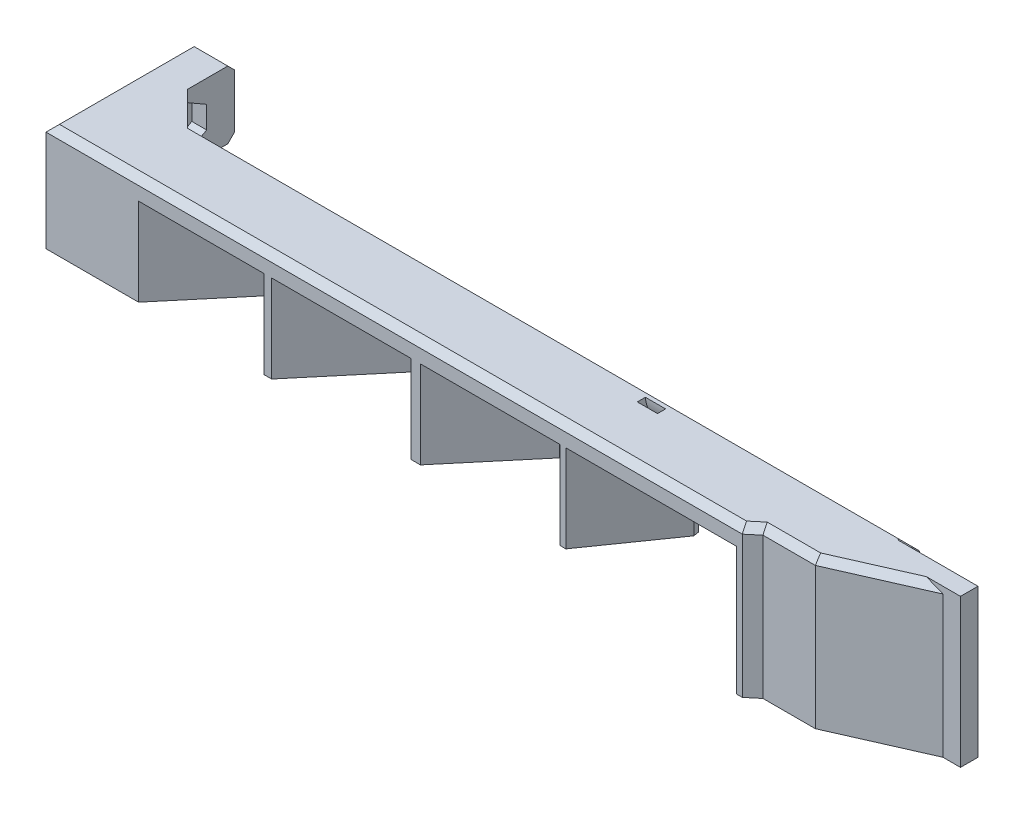
from build123d import *
from OCP.BRepFilletAPI import BRepFilletAPI_MakeChamfer

# Parameters (mm, degrees)
SKETCH1_W           = 126
SKETCH1_H           = 12
BOSS_EXTRUDE1_DEPTH = 16
SKETCH2_W           = 6
SKETCH2_H           = 16
BOSS_EXTRUDE2_DEPTH = 10
SKETCH3_R           = 1.8
CUT_EXTRUDE1_DEPTH  = 10
CUT_EXTRUDE2_DEPTH  = 2.2
CHAMFER1_SIZE       = 3
CUT_EXTRUDE4_DEPTH  = 12
CUT_EXTRUDE5_DEPTH  = 6
SKETCH8_W           = 8.301447347
SKETCH8_H           = 4
CUT_EXTRUDE6_DEPTH  = 2.2
CUT_EXTRUDE7_DEPTH  = 112.589774522
SKETCH10_W          = 2.6
SKETCH10_H          = 16
BOSS_EXTRUDE3_DEPTH = 2.6
CHAMFER2_SIZE       = 2
CHAMFER3_SIZE       = 1
CHAMFER3_SIZE2      = 0.709807814
CHAMFER3_SIZE2_2    = 0.718015043
CUT_EXTRUDE8_START  = -12
SKETCH11_R          = 6
SKETCH11_R_2        = 4.8
CUT_EXTRUDE8_DEPTH  = 3
BOSS_EXTRUDE4_DEPTH = 6
CHAMFER4_SIZE       = 1
CUT_EXTRUDE9_START  = -46
SKETCH13_R          = 6
SKETCH13_R_2        = 4.8
CUT_EXTRUDE9_DEPTH  = 3


with BuildPart() as part:
    # Sketch1 → Boss-Extrude1 (new body)
    with BuildSketch(Plane(origin=(0, 0, 0), x_dir=(1, 0, 0), z_dir=(0, 1, 0))):
        with Locations((46.5, 1.833333333)):
            Rectangle(SKETCH1_W, SKETCH1_H)
    extrude(amount=BOSS_EXTRUDE1_DEPTH)

    # Sketch2 → Boss-Extrude2 (add)
    with BuildSketch(Plane(origin=(0, 0, -7.833333333), x_dir=(-1, 0, 0), z_dir=(0, 0, -1))):
        with Locations((13.5, 8)):
            Rectangle(SKETCH2_W, SKETCH2_H)
    extrude(amount=BOSS_EXTRUDE2_DEPTH)

    # Sketch3 → Cut-Extrude1 (cut)
    with BuildSketch(Plane(origin=(-10.5, 0, 0), x_dir=(0, 0, -1), z_dir=(1, 0, 0))):
        with Locations((10.833333333, 11)):
            Circle(SKETCH3_R)
    extrude(amount=-CUT_EXTRUDE1_DEPTH, mode=Mode.SUBTRACT)

    # Sketch4 → Cut-Extrude2 (cut)
    with BuildSketch(Plane(origin=(-10.5, 0, 0), x_dir=(0, 0, -1), z_dir=(1, 0, 0))):
        Polygon((7.983333333, 12.645448267), (7.983333333, 9.354551733), (10.833333333, 7.709103466), (13.683333333, 9.354551733), (13.683333333, 12.645448267), (10.833333333, 14.290896534), align=None)
    extrude(amount=-CUT_EXTRUDE2_DEPTH, mode=Mode.SUBTRACT)

    # Chamfer1
    # the kernel refuses this chamfer: 3 mm, written as the material it adds along each edge
    with BuildSketch(Plane(origin=(-10.5, 0, -7.833333333), x_dir=(1, 0, 0), z_dir=(0, 1, 0))) as chamfer1_piece_1_section:
        Polygon((CHAMFER1_SIZE, 0), (0, CHAMFER1_SIZE), (0, 0), align=None)
    chamfer1_piece_1 = extrude(amount=16, mode=Mode.PRIVATE)
    chamfer1_piece_1 = split(chamfer1_piece_1, bisect_by=Plane(origin=(-10.5, 0, -7.983333333), z_dir=(0, 0, 1)), keep=Keep.TOP, mode=Mode.PRIVATE)
    add(chamfer1_piece_1)
    with BuildSketch(Plane(origin=(-10.5, 0, -7.833333333), x_dir=(1, 0, 0), z_dir=(0, 1, 0))) as chamfer1_piece_2_section:
        Polygon((CHAMFER1_SIZE, 0), (0, CHAMFER1_SIZE), (0, 0), align=None)
    chamfer1_piece_2 = extrude(amount=23.715048964, mode=Mode.PRIVATE)
    chamfer1_piece_2 = split(chamfer1_piece_2, bisect_by=Plane(origin=(-10.5, 7.080865705, -11.921473054), z_dir=(0, -0.8660254037844421, 0.499999999999994)), keep=Keep.TOP, mode=Mode.PRIVATE)
    add(chamfer1_piece_2)
    with BuildSketch(Plane(origin=(-10.5, -7.715048964, -7.833333333), x_dir=(1, 0, 0), z_dir=(0, 1, 0))) as chamfer1_piece_3_section:
        Polygon((CHAMFER1_SIZE, 0), (0, CHAMFER1_SIZE), (0, 0), align=None)
    chamfer1_piece_3 = extrude(amount=23.715048964, mode=Mode.PRIVATE)
    chamfer1_piece_3 = split(chamfer1_piece_3, bisect_by=Plane(origin=(-10.5, 7.490372054, 0.945520585), z_dir=(0, 0.8660254037844354, 0.5000000000000058)), keep=Keep.TOP, mode=Mode.PRIVATE)
    add(chamfer1_piece_3)

    # Sketch6 → Cut-Extrude4 (cut)
    with BuildSketch(Plane.XZ):
        Polygon((27.078053453, -7.833333333), (47.078053453, -7.833333333), (37.008857879, 4.166666667), (17.008857879, 4.166666667), align=None)
        Polygon((49.166705116, -7.833333333), (67.5, -7.833333333), (59.097509541, 4.166666667), (39.097509541, 4.166666667), align=None)
        Polygon((7.316705116, -7.833333333), (25.228053453, -7.833333333), (15.158857879, 4.166666667), (-2.752490459, 4.166666667), (-1.819672283, 3.054977255), align=None)
        Polygon((60.697509541, 4.166666667), (69.1, -7.833333333), (99.598552653, -7.833333333), (85.297509541, 4.166666667), align=None)
        Polygon((109.5, 2.766666667), (96.345030751, 2.766666667), (109.5, -3.033333333), align=None)
        Polygon((93.814978285, -1.637778805), (96.908239719, -4.233333333), (106.747497018, -4.233333333), (106.747497018, -3.349795), (96.258797751, 1.274651823), align=None)
        Polygon((98.576694749, -5.633333333), (101.198552653, -7.833333333), (109.5, -7.833333333), (109.5, -5.633333333), align=None)
        Polygon((109.5, 4.166666667), (86.897509541, 4.166666667), (88.565964571, 2.766666667), (96.345030751, 2.766666667), (109.5, 2.766666667), align=None)
    extrude(amount=-CUT_EXTRUDE4_DEPTH, mode=Mode.SUBTRACT)

    # Sketch7 → Cut-Extrude5 (cut)
    with BuildSketch(Plane.XZ):
        Polygon((5.466705116, -7.833333333), (-2.924291196, 2.166666667), (-16.5, 2.166666667), (-16.5, -17.833333333), (-10.5, -17.833333333), (-10.5, -10.833333333), (-7.5, -7.833333333), align=None)
    extrude(amount=-CUT_EXTRUDE5_DEPTH, mode=Mode.SUBTRACT)

    # Sketch8 → Cut-Extrude6 (cut)
    with BuildSketch(Plane(origin=(0, 0, -7.833333333), x_dir=(-1, 0, 0), z_dir=(0, 0, -1))):
        with Locations((-105.349276327, 14)):
            Rectangle(SKETCH8_W, SKETCH8_H)
    extrude(amount=-CUT_EXTRUDE6_DEPTH, mode=Mode.SUBTRACT)

    # Sketch9 → Cut-Extrude7 (cut, through all)
    with BuildSketch(Plane.XZ.offset(-12)):
        Polygon((109.5, -3.033333333), (109.5, 4.166666667), (86.897509541, 4.166666667), (88.565964571, 2.766666667), (96.345030751, 2.766666667), align=None)
    extrude(amount=-CUT_EXTRUDE7_DEPTH, mode=Mode.SUBTRACT)

    # Sketch10 → Boss-Extrude3 (add)
    with BuildSketch(Plane(origin=(109.5, 0, 0), x_dir=(0, 0, -1), z_dir=(1, 0, 0))):
        with Locations((4.333333333, 8)):
            Rectangle(SKETCH10_W, SKETCH10_H)
    extrude(amount=BOSS_EXTRUDE3_DEPTH)

    # Chamfer2
    chamfer2_edges = [part.edges().sort_by_distance(p)[0] for p in [
        (46.849276326, 16, -7.833333333),
    ]]
    chamfer(chamfer2_edges, length=CHAMFER2_SIZE)

    # Chamfer3: one chamfer whose edges measure the first distance from different faces: ONE call of the kernel's chamfer builder (chamfer() names one face for all edges)
    chamfer3_edges_1 = [part.edges().sort_by_distance(p)[0] for p in [
        (7.316705116, 6, -7.833333333),
    ]]
    chamfer3_side_1 = [part.faces().sort_by_distance(p)[0] for p in [
        (2.282107329, 6, -1.833333333),
    ]]
    chamfer3_edges_2 = [part.edges().sort_by_distance(p)[0] for p in [
        (15.158857879, 6, 4.166666667),
    ]]
    chamfer3_side_2 = [part.faces().sort_by_distance(p)[0] for p in [
        (20.193455666, 6, -1.833333333),
    ]]
    chamfer3_edges_3 = [part.edges().sort_by_distance(p)[0] for p in [
        (59.097509541, 6, 4.166666667),
    ]]
    chamfer3_side_3 = [part.faces().sort_by_distance(p)[0] for p in [
        (63.298754771, 6, -1.833333333),
    ]]
    chamfer3_edges_4 = [part.edges().sort_by_distance(p)[0] for p in [
        (49.166705116, 6, -7.833333333),
    ]]
    chamfer3_side_4 = [part.faces().sort_by_distance(p)[0] for p in [
        (44.132107329, 6, -1.833333333),
    ]]
    chamfer3_edges_5 = [part.edges().sort_by_distance(p)[0] for p in [
        (37.008857879, 6, 4.166666667),
    ]]
    chamfer3_side_5 = [part.faces().sort_by_distance(p)[0] for p in [
        (42.043455666, 6, -1.833333333),
    ]]
    chamfer3_edges_6 = [part.edges().sort_by_distance(p)[0] for p in [
        (27.078053453, 6, -7.833333333),
    ]]
    chamfer3_side_6 = [part.faces().sort_by_distance(p)[0] for p in [
        (22.043455666, 6, -1.833333333),
    ]]
    chamfer3_edges_7 = [part.edges().sort_by_distance(p)[0] for p in [
        (-13.5, 16, -17.833333333),
        (-13.5, 6, -17.833333333),
        (-16.5, 16, -6.833333333),
        (35.198754771, 16, 4.166666667),
    ]]
    chamfer3_edges_8 = [part.edges().sort_by_distance(p)[0] for p in [
        (85.297509541, 6, 4.166666667),
    ]]
    chamfer3_side_8 = [part.faces().sort_by_distance(p)[0] for p in [
        (92.448031097, 6, -1.833333333),
    ]]
    chamfer3_edges_9 = [part.edges().sort_by_distance(p)[0] for p in [
        (69.1, 6, -7.833333333),
    ]]
    chamfer3_side_9 = [part.faces().sort_by_distance(p)[0] for p in [
        (64.898754771, 6, -1.833333333),
    ]]
    chamfer3 = BRepFilletAPI_MakeChamfer(part.part.solid().wrapped)
    for e in chamfer3_edges_1:
        chamfer3.Add(CHAMFER3_SIZE, CHAMFER3_SIZE2, e.wrapped, chamfer3_side_1[0].wrapped)  # the first distance lies on this face
    for e in chamfer3_edges_2:
        chamfer3.Add(CHAMFER3_SIZE, CHAMFER3_SIZE2, e.wrapped, chamfer3_side_2[0].wrapped)  # the first distance lies on this face
    for e in chamfer3_edges_3:
        chamfer3.Add(CHAMFER3_SIZE, CHAMFER3_SIZE2_2, e.wrapped, chamfer3_side_3[0].wrapped)  # the first distance lies on this face
    for e in chamfer3_edges_4:
        chamfer3.Add(CHAMFER3_SIZE, CHAMFER3_SIZE2, e.wrapped, chamfer3_side_4[0].wrapped)  # the first distance lies on this face
    for e in chamfer3_edges_5:
        chamfer3.Add(CHAMFER3_SIZE, CHAMFER3_SIZE2, e.wrapped, chamfer3_side_5[0].wrapped)  # the first distance lies on this face
    for e in chamfer3_edges_6:
        chamfer3.Add(CHAMFER3_SIZE, CHAMFER3_SIZE2, e.wrapped, chamfer3_side_6[0].wrapped)  # the first distance lies on this face
    for e in chamfer3_edges_7:
        chamfer3.Add(CHAMFER3_SIZE, e.wrapped)
    for e in chamfer3_edges_8:
        chamfer3.Add(CHAMFER3_SIZE, CHAMFER3_SIZE2, e.wrapped, chamfer3_side_8[0].wrapped)  # the first distance lies on this face
    for e in chamfer3_edges_9:
        chamfer3.Add(CHAMFER3_SIZE, CHAMFER3_SIZE2_2, e.wrapped, chamfer3_side_9[0].wrapped)  # the first distance lies on this face
    add(Compound.cast(chamfer3.Shape()), mode=Mode.REPLACE)

    # Sketch11 → Cut-Extrude8 (cut)
    with BuildSketch(Plane.ZY.offset(16.5).offset(CUT_EXTRUDE8_START)):
        with Locations((-9.833333333, 6)):
            Circle(SKETCH11_R)
        with Locations((-9.833333333, 6)):
            Circle(SKETCH11_R_2, mode=Mode.SUBTRACT)
    extrude(amount=-CUT_EXTRUDE8_DEPTH, mode=Mode.SUBTRACT)

    # Sketch12 → Boss-Extrude4 (add)
    with BuildSketch(Plane.XZ):
        Polygon((86.007317356, 4.166666667), (86.063553985, 3.523879057), (99.598552653, -7.833333333), (101.198552653, -7.833333333), (98.576694749, -5.633333333), (112.1, -5.633333333), (112.1, -3.033333333), (109.5, -3.033333333), (96.345030751, 2.766666667), (88.565964571, 2.766666667), (86.897509541, 4.166666667), align=None)
        Polygon((96.258797751, 1.274651823), (93.814978285, -1.637778805), (96.908239719, -4.233333333), (106.747497018, -4.233333333), (106.747497018, -3.349795), align=None, mode=Mode.SUBTRACT)
    extrude(amount=BOSS_EXTRUDE4_DEPTH)

    # Chamfer4
    # the kernel refuses this chamfer: 1 mm, written as the material it takes off along each edge
    with BuildSketch(Plane(origin=(-5.324173446, 12, 4.166666667), x_dir=(0, 1, 0), z_dir=(1, 0, 0))) as chamfer4_piece_1_section:
        Polygon((CHAMFER4_SIZE, 0), (0, -CHAMFER4_SIZE), (0, 0), align=None)
    chamfer4_piece_1 = extrude(amount=23.764522127, mode=Mode.PRIVATE)
    chamfer4_piece_1 = split(chamfer4_piece_1, bisect_by=Plane(origin=(-3.81504792, 12, 5.432973339), z_dir=(0.7660444431189749, 0, 0.6427876096865432)), keep=Keep.TOP, mode=Mode.PRIVATE)
    chamfer4_piece_1 = split(chamfer4_piece_1, bisect_by=Plane(origin=(6.695762747, 12, 14.252590694), z_dir=(-0.766044443118975, 0, -0.642787609686543)), keep=Keep.TOP, mode=Mode.PRIVATE)
    add(chamfer4_piece_1, mode=Mode.SUBTRACT)
    with BuildSketch(Plane(origin=(-5.324173446, 12, 4.166666667), x_dir=(0, 1, 0), z_dir=(1, 0, 0))) as chamfer4_piece_2_section:
        Polygon((CHAMFER4_SIZE, 0), (0, -CHAMFER4_SIZE), (0, 0), align=None)
    chamfer4_piece_2 = extrude(amount=23.764522127, mode=Mode.PRIVATE)
    chamfer4_piece_2 = split(chamfer4_piece_2, bisect_by=Plane(origin=(15.707682269, 12, 2.326617719), z_dir=(-0.9961946980917459, 0, 0.08715574274765488)), keep=Keep.TOP, mode=Mode.PRIVATE)
    chamfer4_piece_2 = split(chamfer4_piece_2, bisect_by=Plane(origin=(6.695762747, 12, 14.252590694), z_dir=(0.766044443118975, 0, 0.642787609686543)), keep=Keep.TOP, mode=Mode.PRIVATE)
    add(chamfer4_piece_2, mode=Mode.SUBTRACT)
    with BuildSketch(Plane(origin=(-5.324173446, 12, 4.166666667), x_dir=(0, 1, 0), z_dir=(1, 0, 0))) as chamfer4_piece_3_section:
        Polygon((CHAMFER4_SIZE, 0), (0, -CHAMFER4_SIZE), (0, 0), align=None)
    chamfer4_piece_3 = extrude(amount=23.764522127, mode=Mode.PRIVATE)
    chamfer4_piece_3 = split(chamfer4_piece_3, bisect_by=Plane(origin=(7.781387312, 12, 15.163537865), z_dir=(0.7660444431189742, 0, 0.642787609686544)), keep=Keep.TOP, mode=Mode.PRIVATE)
    add(chamfer4_piece_3, mode=Mode.SUBTRACT)
    with BuildSketch(Plane(origin=(36.525826554, 12, 4.166666667), x_dir=(0, 1, 0), z_dir=(1, 0, 0))) as chamfer4_piece_4_section:
        Polygon((CHAMFER4_SIZE, 0), (0, -CHAMFER4_SIZE), (0, 0), align=None)
    chamfer4_piece_4 = extrude(amount=25.861381019, mode=Mode.PRIVATE)
    chamfer4_piece_4 = split(chamfer4_piece_4, bisect_by=Plane(origin=(36.809280971, 12, 4.404513164), z_dir=(-0.7660444431189739, 0, -0.6427876096865442)), keep=Keep.TOP, mode=Mode.PRIVATE)
    add(chamfer4_piece_4, mode=Mode.SUBTRACT)
    with BuildSketch(Plane(origin=(36.525826554, 12, 4.166666667), x_dir=(0, 1, 0), z_dir=(1, 0, 0))) as chamfer4_piece_5_section:
        Polygon((CHAMFER4_SIZE, 0), (0, -CHAMFER4_SIZE), (0, 0), align=None)
    chamfer4_piece_5 = extrude(amount=25.861381019, mode=Mode.PRIVATE)
    chamfer4_piece_5 = split(chamfer4_piece_5, bisect_by=Plane(origin=(37.709604739, 12, 4.063099495), z_dir=(-0.9961946980917457, 0, 0.0871557427476573)), keep=Keep.TOP, mode=Mode.PRIVATE)
    add(chamfer4_piece_5, mode=Mode.SUBTRACT)
    with BuildSketch(Plane(origin=(36.525826554, 12, 4.166666667), x_dir=(0, 1, 0), z_dir=(1, 0, 0))) as chamfer4_piece_6_section:
        Polygon((CHAMFER4_SIZE, 0), (0, -CHAMFER4_SIZE), (0, 0), align=None)
    chamfer4_piece_6 = extrude(amount=25.861381019, mode=Mode.PRIVATE)
    chamfer4_piece_6 = split(chamfer4_piece_6, bisect_by=Plane(origin=(38.03495208, 12, 5.432973339), z_dir=(0.7660444431189741, 0, 0.6427876096865441)), keep=Keep.TOP, mode=Mode.PRIVATE)
    chamfer4_piece_6 = split(chamfer4_piece_6, bisect_by=Plane(origin=(51.671653173, 12, 14.771888638), z_dir=(-0.8191520442889891, 0, -0.57357643635105)), keep=Keep.TOP, mode=Mode.PRIVATE)
    add(chamfer4_piece_6, mode=Mode.SUBTRACT)
    with BuildSketch(Plane(origin=(36.525826554, 12, 4.166666667), x_dir=(0, 1, 0), z_dir=(1, 0, 0))) as chamfer4_piece_7_section:
        Polygon((CHAMFER4_SIZE, 0), (0, -CHAMFER4_SIZE), (0, 0), align=None)
    chamfer4_piece_7 = extrude(amount=25.861381019, mode=Mode.PRIVATE)
    chamfer4_piece_7 = split(chamfer4_piece_7, bisect_by=Plane(origin=(59.113254259, 12, 0.183893737), z_dir=(-0.9848077530122082, 0, 0.17364817766692958)), keep=Keep.TOP, mode=Mode.PRIVATE)
    chamfer4_piece_7 = split(chamfer4_piece_7, bisect_by=Plane(origin=(51.671653173, 12, 14.771888638), z_dir=(0.8191520442889891, 0, 0.57357643635105)), keep=Keep.TOP, mode=Mode.PRIVATE)
    add(chamfer4_piece_7, mode=Mode.SUBTRACT)
    with BuildSketch(Plane(origin=(36.525826554, 12, 4.166666667), x_dir=(0, 1, 0), z_dir=(1, 0, 0))) as chamfer4_piece_8_section:
        Polygon((CHAMFER4_SIZE, 0), (0, -CHAMFER4_SIZE), (0, 0), align=None)
    chamfer4_piece_8 = extrude(amount=25.861381019, mode=Mode.PRIVATE)
    chamfer4_piece_8 = split(chamfer4_piece_8, bisect_by=Plane(origin=(52.745269287, 12, 15.523642735), z_dir=(0.8191520442889892, 0, 0.5735764363510499)), keep=Keep.TOP, mode=Mode.PRIVATE)
    add(chamfer4_piece_8, mode=Mode.SUBTRACT)
    with BuildSketch(Plane(origin=(14.437174891, 12, 4.166666667), x_dir=(0, 1, 0), z_dir=(1, 0, 0))) as chamfer4_piece_9_section:
        Polygon((CHAMFER4_SIZE, 0), (0, -CHAMFER4_SIZE), (0, 0), align=None)
    chamfer4_piece_9 = extrude(amount=25.85317379, mode=Mode.PRIVATE)
    chamfer4_piece_9 = split(chamfer4_piece_9, bisect_by=Plane(origin=(14.860675852, 12, 4.522026168), z_dir=(-0.766044443118975, 0, -0.642787609686543)), keep=Keep.TOP, mode=Mode.PRIVATE)
    add(chamfer4_piece_9, mode=Mode.SUBTRACT)
    with BuildSketch(Plane(origin=(14.437174891, 12, 4.166666667), x_dir=(0, 1, 0), z_dir=(1, 0, 0))) as chamfer4_piece_10_section:
        Polygon((CHAMFER4_SIZE, 0), (0, -CHAMFER4_SIZE), (0, 0), align=None)
    chamfer4_piece_10 = extrude(amount=25.85317379, mode=Mode.PRIVATE)
    chamfer4_piece_10 = split(chamfer4_piece_10, bisect_by=Plane(origin=(15.857791912, 12, 4.042378782), z_dir=(-0.9961946980917459, 0, 0.08715574274765488)), keep=Keep.TOP, mode=Mode.PRIVATE)
    add(chamfer4_piece_10, mode=Mode.SUBTRACT)
    with BuildSketch(Plane(origin=(14.437174891, 12, 4.166666667), x_dir=(0, 1, 0), z_dir=(1, 0, 0))) as chamfer4_piece_11_section:
        Polygon((CHAMFER4_SIZE, 0), (0, -CHAMFER4_SIZE), (0, 0), align=None)
    chamfer4_piece_11 = extrude(amount=25.85317379, mode=Mode.PRIVATE)
    chamfer4_piece_11 = split(chamfer4_piece_11, bisect_by=Plane(origin=(15.946300417, 12, 5.432973339), z_dir=(0.7660444431189742, 0, 0.642787609686544)), keep=Keep.TOP, mode=Mode.PRIVATE)
    chamfer4_piece_11 = split(chamfer4_piece_11, bisect_by=Plane(origin=(27.682782193, 12, 15.281050869), z_dir=(-0.7660444431189739, 0, -0.6427876096865442)), keep=Keep.TOP, mode=Mode.PRIVATE)
    add(chamfer4_piece_11, mode=Mode.SUBTRACT)
    with BuildSketch(Plane(origin=(14.437174891, 12, 4.166666667), x_dir=(0, 1, 0), z_dir=(1, 0, 0))) as chamfer4_piece_12_section:
        Polygon((CHAMFER4_SIZE, 0), (0, -CHAMFER4_SIZE), (0, 0), align=None)
    chamfer4_piece_12 = extrude(amount=25.85317379, mode=Mode.PRIVATE)
    chamfer4_piece_12 = split(chamfer4_piece_12, bisect_by=Plane(origin=(37.541816614, 12, 2.145272441), z_dir=(-0.9961946980917457, 0, 0.0871557427476573)), keep=Keep.TOP, mode=Mode.PRIVATE)
    chamfer4_piece_12 = split(chamfer4_piece_12, bisect_by=Plane(origin=(27.682782193, 12, 15.281050869), z_dir=(0.7660444431189739, 0, 0.6427876096865442)), keep=Keep.TOP, mode=Mode.PRIVATE)
    add(chamfer4_piece_12, mode=Mode.SUBTRACT)
    with BuildSketch(Plane(origin=(14.437174891, 12, 4.166666667), x_dir=(0, 1, 0), z_dir=(1, 0, 0))) as chamfer4_piece_13_section:
        Polygon((CHAMFER4_SIZE, 0), (0, -CHAMFER4_SIZE), (0, 0), align=None)
    chamfer4_piece_13 = extrude(amount=25.85317379, mode=Mode.PRIVATE)
    chamfer4_piece_13 = split(chamfer4_piece_13, bisect_by=Plane(origin=(28.908453302, 12, 16.309511045), z_dir=(0.7660444431189741, 0, 0.6427876096865441)), keep=Keep.TOP, mode=Mode.PRIVATE)
    add(chamfer4_piece_13, mode=Mode.SUBTRACT)
    with BuildSketch(Plane(origin=(101.198552653, 16, -8.405016321), x_dir=(-1, 0, 0), z_dir=(0, 0, 1))) as chamfer4_piece_14:
        Polygon((CHAMFER4_SIZE, 0), (0, CHAMFER4_SIZE), (0, 0), align=None)
    extrude(amount=2.771682988, mode=Mode.SUBTRACT)
    with BuildSketch(Plane(origin=(101.198552653, 12, -10.405016321), x_dir=(-1, 0, 0), z_dir=(0, 0, 1))) as chamfer4_piece_15_section:
        Polygon((CHAMFER4_SIZE, 0), (0, -CHAMFER4_SIZE), (0, 0), align=None)
    chamfer4_piece_15 = extrude(amount=4.771682988, mode=Mode.PRIVATE)
    chamfer4_piece_15 = split(chamfer4_piece_15, bisect_by=Plane(origin=(102.464859325, 12, -8.895890795), z_dir=(0.6427876096865404, 0, 0.7660444431189771)), keep=Keep.TOP, mode=Mode.PRIVATE)
    add(chamfer4_piece_15, mode=Mode.SUBTRACT)
    with BuildSketch(Plane(origin=(111.853120449, 16, -4.070819499), x_dir=(0, -1, 0), z_dir=(-0.9150118657328382, 0, 0.40342692717282824))) as chamfer4_piece_16_section:
        Polygon((CHAMFER4_SIZE, 0), (0, -CHAMFER4_SIZE), (0, 0), align=None)
    chamfer4_piece_16 = extrude(amount=19.52019511, mode=Mode.PRIVATE)
    chamfer4_piece_16 = split(chamfer4_piece_16, bisect_by=Plane(origin=(111.853120449, 16, -3.033333333), z_dir=(0, 0, 1)), keep=Keep.TOP, mode=Mode.PRIVATE)
    add(chamfer4_piece_16, mode=Mode.SUBTRACT)
    with BuildSketch(Plane(origin=(98.916713739, 16, 2.766666667), x_dir=(0, -1, 0), z_dir=(-1, 0, 0))) as chamfer4_piece_17_section:
        Polygon((CHAMFER4_SIZE, 0), (0, -CHAMFER4_SIZE), (0, 0), align=None)
    chamfer4_piece_17 = extrude(amount=12.922432156, mode=Mode.PRIVATE)
    chamfer4_piece_17 = split(chamfer4_piece_17, bisect_by=Plane(origin=(96.456979825, 12.173333342, -0.164730062), z_dir=(0.4545194776720475, 0.7071067811865437, 0.5416752204197035)), keep=Keep.TOP, mode=Mode.PRIVATE)
    add(chamfer4_piece_17, mode=Mode.SUBTRACT)
    with BuildSketch(Plane(origin=(90.535988034, 16, 1.113620706), x_dir=(0, -1, 0), z_dir=(-0.7660444431189763, 0, 0.6427876096865415))) as chamfer4_piece_18_section:
        Polygon((CHAMFER4_SIZE, 0), (0, -CHAMFER4_SIZE), (0, 0), align=None)
    chamfer4_piece_18 = extrude(amount=5.765655507, mode=Mode.PRIVATE)
    chamfer4_piece_18 = split(chamfer4_piece_18, bisect_by=Plane(origin=(90.535988034, 16.32652298, 1.440143686), z_dir=(0, 0.7071067811865476, 0.7071067811865476)), keep=Keep.TOP, mode=Mode.PRIVATE)
    add(chamfer4_piece_18, mode=Mode.SUBTRACT)
    with BuildSketch(Plane(origin=(58.125826554, 12, 4.166666667), x_dir=(0, 1, 0), z_dir=(1, 0, 0))) as chamfer4_piece_19_section:
        Polygon((CHAMFER4_SIZE, 0), (0, -CHAMFER4_SIZE), (0, 0), align=None)
    chamfer4_piece_19 = extrude(amount=30.45317379, mode=Mode.PRIVATE)
    chamfer4_piece_19 = split(chamfer4_piece_19, bisect_by=Plane(origin=(58.777835625, 12, 4.623208333), z_dir=(-0.8191520442889891, 0, -0.57357643635105)), keep=Keep.TOP, mode=Mode.PRIVATE)
    add(chamfer4_piece_19, mode=Mode.SUBTRACT)
    with BuildSketch(Plane(origin=(58.125826554, 12, 4.166666667), x_dir=(0, 1, 0), z_dir=(1, 0, 0))) as chamfer4_piece_20_section:
        Polygon((CHAMFER4_SIZE, 0), (0, -CHAMFER4_SIZE), (0, 0), align=None)
    chamfer4_piece_20 = extrude(amount=30.45317379, mode=Mode.PRIVATE)
    chamfer4_piece_20 = split(chamfer4_piece_20, bisect_by=Plane(origin=(59.764573955, 12, 3.877711285), z_dir=(-0.9848077530122082, 0, 0.17364817766692958)), keep=Keep.TOP, mode=Mode.PRIVATE)
    add(chamfer4_piece_20, mode=Mode.SUBTRACT)
    with BuildSketch(Plane(origin=(58.125826554, 12, 4.166666667), x_dir=(0, 1, 0), z_dir=(1, 0, 0))) as chamfer4_piece_21_section:
        Polygon((CHAMFER4_SIZE, 0), (0, -CHAMFER4_SIZE), (0, 0), align=None)
    chamfer4_piece_21 = extrude(amount=30.45317379, mode=Mode.PRIVATE)
    chamfer4_piece_21 = split(chamfer4_piece_21, bisect_by=Plane(origin=(59.85145174, 12, 5.37496243), z_dir=(0.8191520442889892, 0, 0.5735764363510499)), keep=Keep.TOP, mode=Mode.PRIVATE)
    chamfer4_piece_21 = split(chamfer4_piece_21, bisect_by=Plane(origin=(69.35251143, 12, 17.546108701), z_dir=(-0.6427876096865347, 0, -0.766044443118982)), keep=Keep.TOP, mode=Mode.PRIVATE)
    add(chamfer4_piece_21, mode=Mode.SUBTRACT)
    with BuildSketch(Plane(origin=(58.125826554, 12, 4.166666667), x_dir=(0, 1, 0), z_dir=(1, 0, 0))) as chamfer4_piece_22_section:
        Polygon((CHAMFER4_SIZE, 0), (0, -CHAMFER4_SIZE), (0, 0), align=None)
    chamfer4_piece_22 = extrude(amount=30.45317379, mode=Mode.PRIVATE)
    chamfer4_piece_22 = split(chamfer4_piece_22, bisect_by=Plane(origin=(85.795526108, 12, 6.587451701), z_dir=(-0.9961946980917439, 0, -0.08715574274767737)), keep=Keep.TOP, mode=Mode.PRIVATE)
    chamfer4_piece_22 = split(chamfer4_piece_22, bisect_by=Plane(origin=(69.35251143, 12, 17.546108701), z_dir=(0.6427876096865347, 0, 0.766044443118982)), keep=Keep.TOP, mode=Mode.PRIVATE)
    add(chamfer4_piece_22, mode=Mode.SUBTRACT)

    # Sketch13 → Cut-Extrude9 (cut)
    with BuildSketch(Plane(origin=(112.1, 0, 0), x_dir=(0, 0, -1), z_dir=(1, 0, 0)).offset(CUT_EXTRUDE9_START)):
        with Locations((10.033333333, 16.3)):
            Circle(SKETCH13_R)
        with Locations((10.033333333, 16.3)):
            Circle(SKETCH13_R_2, mode=Mode.SUBTRACT)
    extrude(amount=-CUT_EXTRUDE9_DEPTH, mode=Mode.SUBTRACT)


solid = part.part
